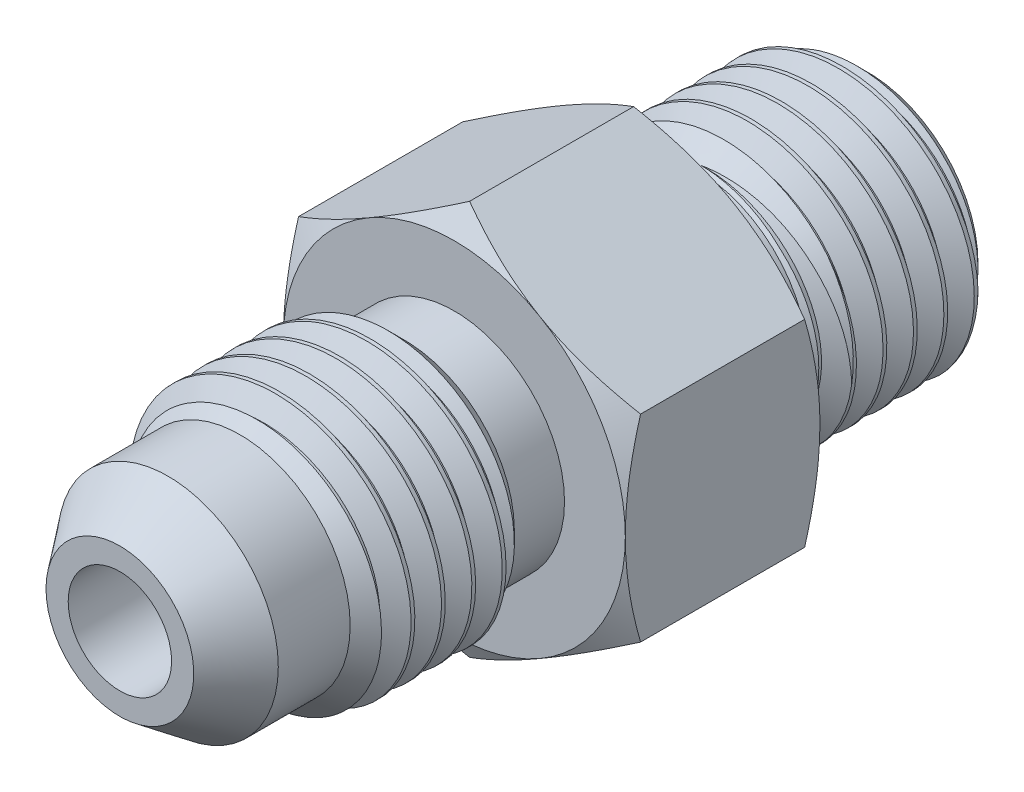
from build123d import *

# Parameters (mm, degrees)
BOSS_EXTRUDE1_DEPTH    = 8.128
SKETCH6_OUTSIDE_W      = 98.146
SKETCH6_OUTSIDE_H      = 100.356
SKETCH6_OUTSIDE_R      = 7.14375
CUT_EXTRUDE1_DEPTH     = 21.430354055
CUT_EXTRUDE1_DRAFT     = -60
SKETCH7_OUTSIDE_W      = 112.748
SKETCH7_OUTSIDE_H      = 114.958
SKETCH7_OUTSIDE_R      = 7.14375
CUT_EXTRUDE2_DEPTH     = 25.645465847
CUT_EXTRUDE2_DRAFT     = -60
SKETCH8_R              = 0.47625
CUT_SWEEP1_PITCH       = 1.27
CUT_SWEEP1_HEIGHT      = 8.128
CUT_SWEEP1_RADIUS      = 5.55625
CUT_SWEEP1_START_ANGLE = 90
CUT_SWEEP2_PITCH       = 1.27
BOSS_EXTRUDE2_START    = -8.128
SKETCH13_R             = 7.14375
SKETCH13_R_2           = 2.159
BOSS_EXTRUDE2_DEPTH    = 8.128


with BuildPart() as part:
    # Sketch3 → Revolve1 (revolve)
    with BuildSketch(Plane(origin=(0, 0, 0), x_dir=(0, 0, -1), z_dir=(1, 0, 0)), mode=Mode.PRIVATE) as revolve1_sk:
        Polygon((-3.7465, 4.60375), (-1.651, 4.60375), (6.477, 4.60375), (8.509, 4.60375), (9.4615, 5.55625), (14.6685, 5.55625), (15.621, 4.60375), (15.621, 2.159), (6.477, 2.159), (-1.651, 2.159), (-15.621, 2.159), (-15.621, 3.0861), (-13.607010426, 4.60375), (-10.6045, 4.60375), (-9.652, 5.55625), (-4.699, 5.55625), align=None)
    revolve(revolve1_sk.sketch.rotate(Axis((0, 0, -15.621), (0, 0, 1)), 90), axis=Axis((0, 0, -15.621), (0, 0, 1)))

    # Sketch4 → Boss-Extrude1 (add)
    with BuildSketch(Plane.XY.offset(1.651)):
        Polygon((-7.14375, 4.124445986), (-7.14375, -4.124445986), (0, -8.248891971), (7.14375, -4.124445986), (7.14375, 4.124445986), (0, 8.248891971), align=None)
    extrude(amount=-BOSS_EXTRUDE1_DEPTH)

    # Sketch5 → Cut-Revolve1 (revolve, cut)
    with BuildSketch(Plane(origin=(0, 0, 0), x_dir=(0, 0, -1), z_dir=(1, 0, 0)), mode=Mode.PRIVATE) as cut_revolve1_sk:
        Polygon((15.621, 0), (-15.621, 0), (-15.621, 2.159), (-1.651, 2.159), (6.477, 2.159), (15.621, 2.159), align=None)
    revolve(cut_revolve1_sk.sketch.rotate(Axis((0, 0, -15.621), (0, 0, 1)), 90), axis=Axis((0, 0, -15.621), (0, 0, 1)), mode=Mode.SUBTRACT)


with BuildPart() as cut_extrude1_tool:
    # Sketch6 outside → Cut-Extrude1 (with draft: the straight prism first)
    with BuildSketch(Plane.XY.offset(1.651)):
        Rectangle(SKETCH6_OUTSIDE_W, SKETCH6_OUTSIDE_H)
        Circle(SKETCH6_OUTSIDE_R, mode=Mode.SUBTRACT)
    extrude(amount=-CUT_EXTRUDE1_DEPTH)
    # Cut-Extrude1: the draft: its side faces are tilted about the plane it starts from
    cut_extrude1_sides = [cut_extrude1_tool.faces().sort_by_distance(p)[0] for p in [
        (0, -50.178, -9.064177027),
        (49.073, 0, -9.064177027),
        (0, 50.178, -9.064177027),
        (-49.073, 0, -9.064177027),
        (-7.14375, 0, -9.064177027),
    ]]
    draft(cut_extrude1_sides, Plane.XY.offset(1.651), CUT_EXTRUDE1_DRAFT)


with BuildPart() as part_1:
    add(part.part)

    # Cut-Extrude1: cut by cut_extrude1_tool
    add(cut_extrude1_tool.part, mode=Mode.SUBTRACT)


with BuildPart() as cut_extrude2_tool:
    # Sketch7 outside → Cut-Extrude2 (with draft: the straight prism first)
    with BuildSketch(Plane(origin=(0, 0, -6.477), x_dir=(-1, 0, 0), z_dir=(0, 0, -1))):
        Rectangle(SKETCH7_OUTSIDE_W, SKETCH7_OUTSIDE_H)
        Circle(SKETCH7_OUTSIDE_R, mode=Mode.SUBTRACT)
    extrude(amount=-CUT_EXTRUDE2_DEPTH)
    # Cut-Extrude2: the draft: its side faces are tilted about the plane it starts from
    cut_extrude2_sides = [cut_extrude2_tool.faces().sort_by_distance(p)[0] for p in [
        (0, -57.479, 6.345732923),
        (-56.374, 0, 6.345732923),
        (0, 57.479, 6.345732923),
        (56.374, 0, 6.345732923),
        (7.14375, 0, 6.345732923),
    ]]
    draft(cut_extrude2_sides, Plane(origin=(0, 0, -6.477), x_dir=(-1, 0, 0), z_dir=(0, 0, -1)), CUT_EXTRUDE2_DRAFT)


with BuildPart() as part_2:
    add(part_1.part)

    # Cut-Extrude2: cut by cut_extrude2_tool
    add(cut_extrude2_tool.part, mode=Mode.SUBTRACT)

    # Cut-Sweep1: sweep along a helix
    with BuildLine() as cut_sweep1_path:
        add(Helix(CUT_SWEEP1_PITCH, CUT_SWEEP1_HEIGHT, CUT_SWEEP1_RADIUS, center=(0, 0, 10.6045), direction=(0, 0, -1), mode=Mode.PRIVATE).rotate(Axis((0, 0, 10.6045), (0, 0, -1)), CUT_SWEEP1_START_ANGLE))
    # Sketch10 → Cut-Sweep1 (sweep, cut)
    with BuildSketch(Plane(origin=(0, 0, 0), x_dir=(0, 0, -1), z_dir=(1, 0, 0))):
        Polygon((-11.2395, 4.731360803), (-11.08075, 4.731360803), (-10.5648125, 5.624990766), (-11.7554375, 5.624990766), align=None)
    sweep(path=cut_sweep1_path.line, is_frenet=True, mode=Mode.SUBTRACT)

    # Cut-Sweep2: the profile of Sketch12 screwed along a right-hand helix of 6.6 turns, 8 arcs to a turn; built about Z, then put on its axis
    cut_sweep2_z = Axis((0, 0, 0), (0, 0, 1))
    cut_sweep2_corners = [(4.731360803, 0, -0.47625), (5.624990766, 0, 0.0396875), (5.624990766, 0, -1.1509375), (4.731360803, 0, -0.635)]
    with BuildLine(mode=Mode.PRIVATE) as cut_sweep2_profile:
        Line(cut_sweep2_corners[0], cut_sweep2_corners[1])
        Line(cut_sweep2_corners[1], cut_sweep2_corners[2])
        Line(cut_sweep2_corners[2], cut_sweep2_corners[3])
        Line(cut_sweep2_corners[3], cut_sweep2_corners[0])
    cut_sweep2_cap = Face(cut_sweep2_profile.wire())
    cut_sweep2_turn_angles = [0, 22.5, 45, 67.5, 90, 112.5, 135, 157.5, 180, 202.5, 225, 247.5, 270, 292.5, 315, 337.5, 360]
    cut_sweep2_turn_weights = [1, 0.9238795325112867, 1, 0.9238795325112867, 1, 0.9238795325112867, 1, 0.9238795325112867, 1, 0.9238795325112867, 1, 0.9238795325112867, 1, 0.9238795325112867, 1, 0.9238795325112867, 1]
    cut_sweep2_turn_rails = [Edge.make_bspline([Vector(p[0], p[1], 0).rotate(cut_sweep2_z, cut_sweep2_turn_angles[k]) / cut_sweep2_turn_weights[k] + Vector(0, 0, p[2] + CUT_SWEEP2_PITCH * cut_sweep2_turn_angles[k] / 360) for k in range(17)], [0, 0, 0, 1, 1, 2, 2, 3, 3, 4, 4, 5, 5, 6, 6, 7, 7, 8, 8, 8], 2, cut_sweep2_turn_weights) for p in cut_sweep2_corners]
    cut_sweep2_turn_sides = [Face.make_surface_from_curves(cut_sweep2_turn_rails[p[0]], cut_sweep2_turn_rails[p[1]]) for p in [(0, 1), (1, 2), (2, 3), (3, 0)]]
    cut_sweep2_last_angles = [2160, 2182.5, 2205, 2227.5, 2250, 2272.5, 2295, 2317.5, 2340, 2358, 2376]
    cut_sweep2_last_weights = [1, 0.9238795325112867, 1, 0.9238795325112867, 1, 0.9238795325112867, 1, 0.9238795325112867, 1, 0.951056516295145, 1]
    cut_sweep2_last_rails = [Edge.make_bspline([Vector(p[0], p[1], 0).rotate(cut_sweep2_z, cut_sweep2_last_angles[k]) / cut_sweep2_last_weights[k] + Vector(0, 0, p[2] + CUT_SWEEP2_PITCH * cut_sweep2_last_angles[k] / 360) for k in range(11)], [0, 0, 0, 1, 1, 2, 2, 3, 3, 4, 4, 5, 5, 5], 2, cut_sweep2_last_weights) for p in cut_sweep2_corners]
    cut_sweep2_last_sides = [Face.make_surface_from_curves(cut_sweep2_last_rails[p[0]], cut_sweep2_last_rails[p[1]]) for p in [(0, 1), (1, 2), (2, 3), (3, 0)]]
    cut_sweep2 = Plane(origin=(0, 0, -15.621), x_dir=(0, 1, 0), z_dir=(0, 0, 1)) * Solid(Shell([*[p.moved(Location((0, 0, CUT_SWEEP2_PITCH * i))) for i in range(6) for p in cut_sweep2_turn_sides], *cut_sweep2_last_sides, cut_sweep2_cap, cut_sweep2_cap.rotate(cut_sweep2_z, 2376).moved(Location((0, 0, CUT_SWEEP2_PITCH * 2376 / 360)))]))
    add(cut_sweep2, mode=Mode.SUBTRACT)

    # Sketch13 → Boss-Extrude2 (add)
    with BuildSketch(Plane(origin=(0, 0, -6.477), x_dir=(-1, 0, 0), z_dir=(0, 0, -1)).offset(BOSS_EXTRUDE2_START)):
        Circle(SKETCH13_R)
        Circle(SKETCH13_R_2, mode=Mode.SUBTRACT)
    extrude(amount=BOSS_EXTRUDE2_DEPTH)


with BuildPart() as body_2:
    # Sketch8 → Revolve2 (revolve)
    with BuildSketch(Plane(origin=(0, 0, 0), x_dir=(0, 0, -1), z_dir=(1, 0, 0)), mode=Mode.PRIVATE) as revolve2_sk:
        with Locations((6.95325, 5.08)):
            Circle(SKETCH8_R)
    revolve(revolve2_sk.sketch.rotate(Axis((0, 0, -15.621), (0, 0, 1)), 90), axis=Axis((0, 0, -15.621), (0, 0, 1)))


solid = Compound([part_2.part, body_2.part])
